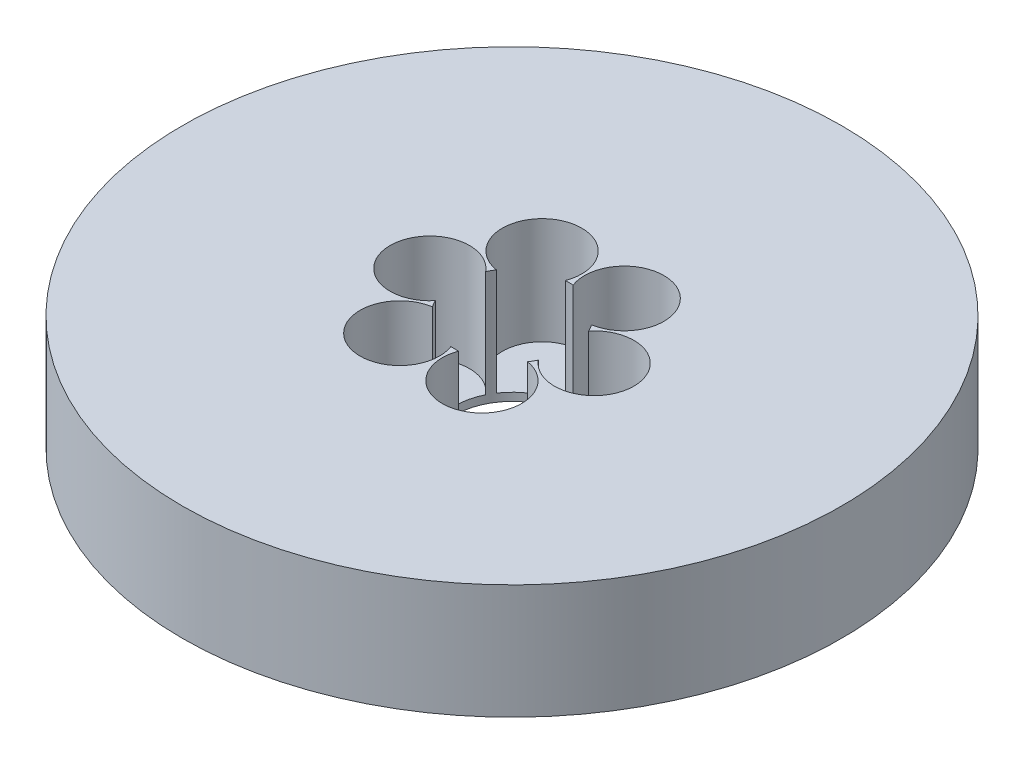
from build123d import *

# Parameters (mm, degrees)
SKETCH1_R           = 57.5
BOSS_EXTRUDE1_DEPTH = 20
SKETCH2_R           = 10
CUT_EXTRUDE1_DEPTH  = 84.740671122
SKETCH3_R           = 6.928124531
CUT_EXTRUDE2_DEPTH  = 18.611010713
CIRPATTERN1_COUNT   = 6


with BuildPart() as part:
    # Sketch1 → Boss-Extrude1 (new body)
    with BuildSketch(Plane(origin=(0, 0, 0), x_dir=(1, 0, 0), z_dir=(0, 1, 0))):
        Circle(SKETCH1_R)
    extrude(amount=BOSS_EXTRUDE1_DEPTH)

    # Sketch2 → Cut-Extrude1 (cut, through all)
    with BuildSketch(Plane(origin=(0, 0, 0), x_dir=(1, 0, 0), z_dir=(0, 1, 0))):
        Circle(SKETCH2_R)
    extrude(amount=CUT_EXTRUDE1_DEPTH, mode=Mode.SUBTRACT)

    # Sketch3 → Cut-Extrude2 (cut)
    with BuildSketch(Plane(origin=(0, 20, 0), x_dir=(1, 0, 0), z_dir=(0, 1, 0))):
        with Locations((-14.335461996, 0)):
            Circle(SKETCH3_R)
    cut_extrude2 = extrude(amount=-CUT_EXTRUDE2_DEPTH, mode=Mode.SUBTRACT)

    # CirPattern1: Cut-Extrude2 ×6 about axis
    cirpattern1_axis = Axis((0, 0, 0), (0, 1, 0))
    for i in range(1, CIRPATTERN1_COUNT):
        add(cut_extrude2.rotate(cirpattern1_axis, i * 360 / CIRPATTERN1_COUNT), mode=Mode.SUBTRACT)


solid = part.part
